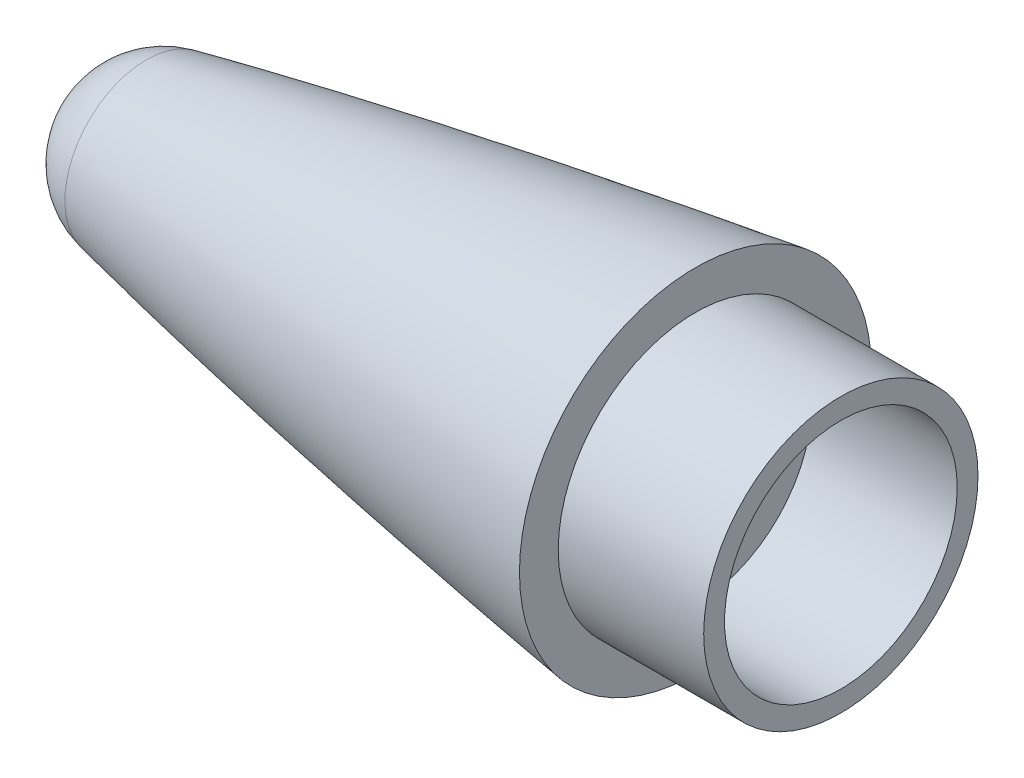
from build123d import *

# Parameters (mm, degrees)
SKETCH3_R           = 33
SKETCH3_R_2         = 28
BOSS_EXTRUDE1_DEPTH = 35


with BuildPart() as part:
    # Sketch1 → Revolve1 (revolve)
    with BuildSketch(Plane.XY):
        with BuildLine():
            Line((200, 0), (200, 42.32828037))
            add(Edge.make_bspline(
                [(67.88595875, 19.569501359), (71.843085895, 20.404078353), (85.043129663, 23.124182603), (107.543506327, 27.445507457), (139.404169497, 33.021435572), (168.514660807, 37.655823826), (188.335942781, 40.630483181), (198.835243463, 42.159255501), (200, 42.32828037)],
                knots=[0.116883244, 0.116883244, 0.116883244, 0.116883244, 0.116883244, 0.143539857, 0.205716573, 0.267893284, 0.330069995, 0.337827743, 0.337827743, 0.337827743, 0.337827743, 0.337827743], degree=4))
            ThreePointArc((67.88595875, 19.569501359), (56.48029473, 12.598689867), (52.013260114, 0))
            Line((52.013260114, 0), (200, 0))
        make_face()
    revolve(axis=Axis((806.72, 0, 0), (-1, 0, 0)))

    # Sketch3 → Boss-Extrude1 (add)
    with BuildSketch(Plane(origin=(200, 0, 0), x_dir=(0, 0, -1), z_dir=(1, 0, 0))):
        Circle(SKETCH3_R)
        Circle(SKETCH3_R_2, mode=Mode.SUBTRACT)
    extrude(amount=BOSS_EXTRUDE1_DEPTH)


solid = part.part
